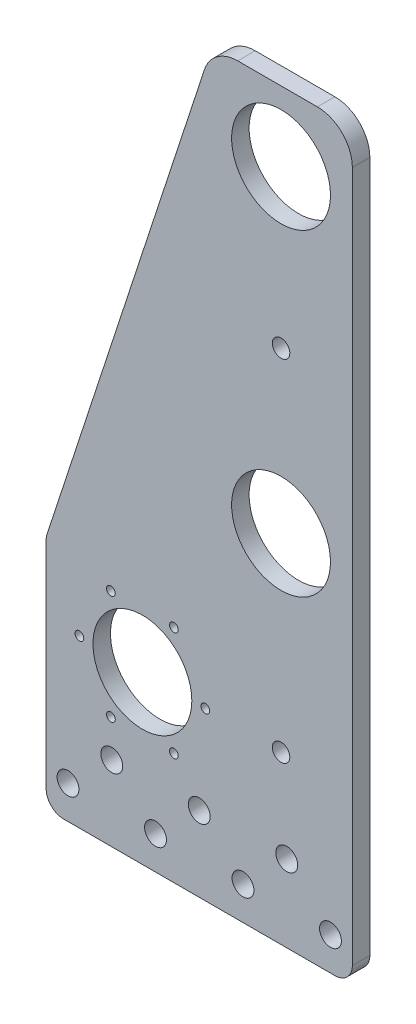
from build123d import *

# Parameters (mm, degrees)
SKETCH1_R           = 14.351
SKETCH1_R_2         = 2.54
SKETCH1_R_3         = 3.175
SKETCH1_R_4         = 1.27
BOSS_EXTRUDE1_DEPTH = 5.08


with BuildPart() as part:
    # Sketch1 → Boss-Extrude1 (new body)
    with BuildSketch(Plane.XY):
        with BuildLine():
            Line((88.9, 205.74), (88.9, 5.08))
            ThreePointArc((88.9, 5.08), (87.412102448, 1.487897552), (83.82, 0))
            Line((83.82, 0), (5.08, 0))
            ThreePointArc((5.08, 0), (1.487897552, 1.487897552), (0, 5.08))
            Line((0, 5.08), (0, 67.619993162))
            ThreePointArc((0, 67.619993162), (0.063384098, 68.419971217), (0.25195468, 69.199986324))
            Line((0.25195468, 69.199986324), (45.969223296, 208.899986324))
            ThreePointArc((45.969223296, 208.899986324), (49.662087504, 213.965906061), (55.625313935, 215.9))
            Line((55.625313935, 215.9), (78.74, 215.9))
            ThreePointArc((78.74, 215.9), (85.924204897, 212.924204897), (88.9, 205.74))
        make_face()
        with Locations((68.199, 195.58)):
            Circle(SKETCH1_R, mode=Mode.SUBTRACT)
        with Locations((68.199, 103.378)):
            Circle(SKETCH1_R, mode=Mode.SUBTRACT)
        with Locations((68.199, 149.95398)):
            Circle(SKETCH1_R_2, mode=Mode.SUBTRACT)
        with Locations((68.199, 48.35398)):
            Circle(SKETCH1_R_2, mode=Mode.SUBTRACT)
        with Locations((27.94, 48.35398)):
            Circle(SKETCH1_R, mode=Mode.SUBTRACT)
        with Locations((6.35, 9.652)):
            Circle(SKETCH1_R_3, mode=Mode.SUBTRACT)
        with Locations((31.75, 9.652)):
            Circle(SKETCH1_R_3, mode=Mode.SUBTRACT)
        with Locations((57.15, 9.652)):
            Circle(SKETCH1_R_3, mode=Mode.SUBTRACT)
        with Locations((82.55, 9.652)):
            Circle(SKETCH1_R_3, mode=Mode.SUBTRACT)
        with Locations((69.85, 22.352)):
            Circle(SKETCH1_R_3, mode=Mode.SUBTRACT)
        with Locations((44.45, 21.844)):
            Circle(SKETCH1_R_3, mode=Mode.SUBTRACT)
        with Locations((19.05, 21.844)):
            Circle(SKETCH1_R_3, mode=Mode.SUBTRACT)
        with Locations((46.228, 48.35398)):
            Circle(SKETCH1_R_4, mode=Mode.SUBTRACT)
        with Locations((37.084, 32.516107416)):
            Circle(SKETCH1_R_4, mode=Mode.SUBTRACT)
        with Locations((18.796, 32.516107416)):
            Circle(SKETCH1_R_4, mode=Mode.SUBTRACT)
        with Locations((9.652, 48.35398)):
            Circle(SKETCH1_R_4, mode=Mode.SUBTRACT)
        with Locations((18.796, 64.191852584)):
            Circle(SKETCH1_R_4, mode=Mode.SUBTRACT)
        with Locations((37.084, 64.191852584)):
            Circle(SKETCH1_R_4, mode=Mode.SUBTRACT)
    extrude(amount=BOSS_EXTRUDE1_DEPTH)


solid = part.part
